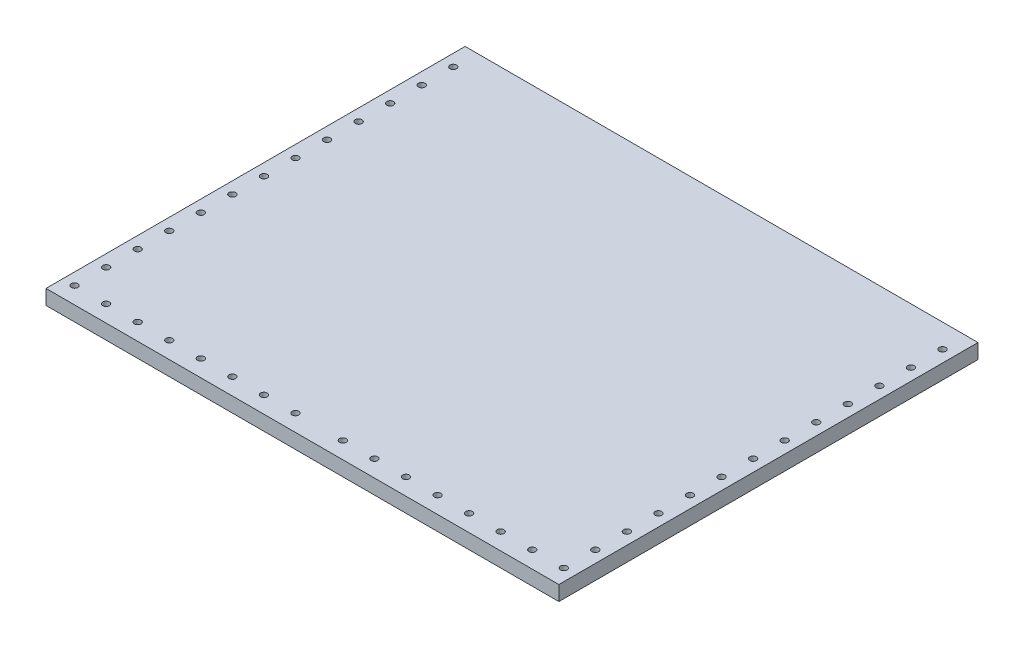
from build123d import *

# Parameters (mm, degrees)
SKETCH1_W           = 412.75
SKETCH1_H           = 584.2
BOSS_EXTRUDE1_DEPTH = 11.90625
SKETCH2_W           = 40.64
SKETCH2_H           = 139.7
CUT_EXTRUDE1_DEPTH  = 716.397764386
SKETCH3_R           = 2.667
CUT_EXTRUDE2_DEPTH  = 254
SKETCH4_W           = 412.75
SKETCH4_H           = 246.888
CUT_EXTRUDE4_DEPTH  = 716.397764386


with BuildPart() as part:
    # Sketch1 → Boss-Extrude1 (new body)
    with BuildSketch(Plane(origin=(0, 0, 0), x_dir=(1, 0, 0), z_dir=(0, 1, 0))):
        with Locations((206.375, 292.1)):
            Rectangle(SKETCH1_W, SKETCH1_H)
    extrude(amount=BOSS_EXTRUDE1_DEPTH)

    # Sketch2 → Cut-Extrude1 (cut, through all)
    with BuildSketch(Plane(origin=(0, 11.90625, 0), x_dir=(1, 0, 0), z_dir=(0, 1, 0))):
        with Locations((20.32, 407.162)):
            Rectangle(SKETCH2_W, SKETCH2_H)
        with Locations((392.43, 407.162)):
            Rectangle(SKETCH2_W, SKETCH2_H)
    extrude(amount=-CUT_EXTRUDE1_DEPTH, mode=Mode.SUBTRACT)

    # Sketch3 → Cut-Extrude2 (cut)
    with BuildSketch(Plane(origin=(0, 11.90625, 0), x_dir=(1, 0, 0), z_dir=(0, 1, 0))):
        with Locations((9.525, 13.462)):
            Circle(SKETCH3_R)
        with Locations((34.925, 13.462)):
            Circle(SKETCH3_R)
        with Locations((60.325, 13.462)):
            Circle(SKETCH3_R)
        with Locations((85.725, 13.462)):
            Circle(SKETCH3_R)
        with Locations((111.125, 13.462)):
            Circle(SKETCH3_R)
        with Locations((136.525, 13.462)):
            Circle(SKETCH3_R)
        with Locations((161.925, 13.462)):
            Circle(SKETCH3_R)
        with Locations((187.325, 13.462)):
            Circle(SKETCH3_R)
        with Locations((225.425, 13.462)):
            Circle(SKETCH3_R)
        with Locations((250.825, 13.462)):
            Circle(SKETCH3_R)
        with Locations((276.225, 13.462)):
            Circle(SKETCH3_R)
        with Locations((301.625, 13.462)):
            Circle(SKETCH3_R)
        with Locations((327.025, 13.462)):
            Circle(SKETCH3_R)
        with Locations((352.425, 13.462)):
            Circle(SKETCH3_R)
        with Locations((377.825, 13.462)):
            Circle(SKETCH3_R)
        with Locations((403.225, 13.462)):
            Circle(SKETCH3_R)
        with Locations((403.225, 38.862)):
            Circle(SKETCH3_R)
        with Locations((403.225, 64.262)):
            Circle(SKETCH3_R)
        with Locations((403.225, 89.662)):
            Circle(SKETCH3_R)
        with Locations((403.225, 115.062)):
            Circle(SKETCH3_R)
        with Locations((403.225, 140.462)):
            Circle(SKETCH3_R)
        with Locations((403.225, 165.862)):
            Circle(SKETCH3_R)
        with Locations((403.225, 191.262)):
            Circle(SKETCH3_R)
        with Locations((403.225, 216.662)):
            Circle(SKETCH3_R)
        with Locations((403.225, 242.062)):
            Circle(SKETCH3_R)
        with Locations((403.225, 267.462)):
            Circle(SKETCH3_R)
        with Locations((403.225, 292.862)):
            Circle(SKETCH3_R)
        with Locations((403.225, 318.262)):
            Circle(SKETCH3_R)
        with Locations((403.225, 343.662)):
            Circle(SKETCH3_R)
        with Locations((403.225, 369.062)):
            Circle(SKETCH3_R)
        with Locations((403.225, 394.462)):
            Circle(SKETCH3_R)
        with Locations((403.225, 419.862)):
            Circle(SKETCH3_R)
        with Locations((403.225, 445.262)):
            Circle(SKETCH3_R)
        with Locations((403.225, 470.662)):
            Circle(SKETCH3_R)
        with Locations((403.225, 496.062)):
            Circle(SKETCH3_R)
        with Locations((403.225, 521.462)):
            Circle(SKETCH3_R)
        with Locations((403.225, 546.862)):
            Circle(SKETCH3_R)
        with Locations((403.225, 572.262)):
            Circle(SKETCH3_R)
        with Locations((9.525, 38.862)):
            Circle(SKETCH3_R)
        with Locations((9.525, 64.262)):
            Circle(SKETCH3_R)
        with Locations((9.525, 89.662)):
            Circle(SKETCH3_R)
        with Locations((9.525, 115.062)):
            Circle(SKETCH3_R)
        with Locations((9.525, 140.462)):
            Circle(SKETCH3_R)
        with Locations((9.525, 165.862)):
            Circle(SKETCH3_R)
        with Locations((9.525, 191.262)):
            Circle(SKETCH3_R)
        with Locations((9.525, 216.662)):
            Circle(SKETCH3_R)
        with Locations((9.525, 242.062)):
            Circle(SKETCH3_R)
        with Locations((9.525, 267.462)):
            Circle(SKETCH3_R)
        with Locations((9.525, 292.862)):
            Circle(SKETCH3_R)
        with Locations((9.525, 318.262)):
            Circle(SKETCH3_R)
        with Locations((9.525, 343.662)):
            Circle(SKETCH3_R)
        with Locations((9.525, 369.062)):
            Circle(SKETCH3_R)
        with Locations((9.525, 394.462)):
            Circle(SKETCH3_R)
        with Locations((9.525, 419.862)):
            Circle(SKETCH3_R)
        with Locations((9.525, 445.262)):
            Circle(SKETCH3_R)
        with Locations((9.525, 470.662)):
            Circle(SKETCH3_R)
        with Locations((9.525, 496.062)):
            Circle(SKETCH3_R)
        with Locations((9.525, 521.462)):
            Circle(SKETCH3_R)
        with Locations((9.525, 546.862)):
            Circle(SKETCH3_R)
        with Locations((9.525, 572.262)):
            Circle(SKETCH3_R)
    extrude(amount=-CUT_EXTRUDE2_DEPTH, mode=Mode.SUBTRACT)

    # Sketch4 → Cut-Extrude4 (cut, through all)
    with BuildSketch(Plane(origin=(0, 11.90625, 0), x_dir=(1, 0, 0), z_dir=(0, 1, 0))):
        with Locations((206.375, 460.756)):
            Rectangle(SKETCH4_W, SKETCH4_H)
    extrude(amount=-CUT_EXTRUDE4_DEPTH, mode=Mode.SUBTRACT)


solid = part.part
